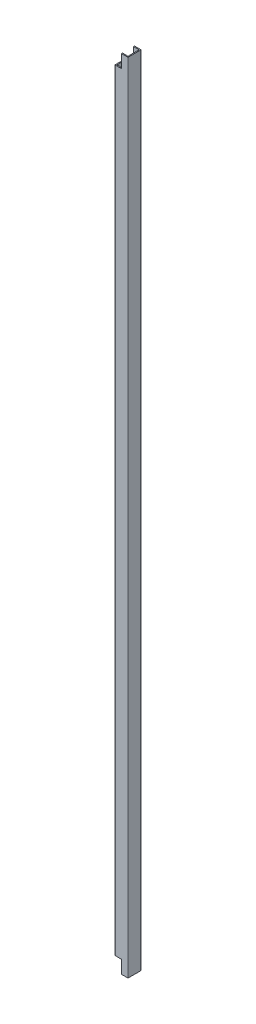
from build123d import *

# Parameters (mm, degrees)
SKETCH1_W                   = 17
SKETCH1_H                   = 17
BOSS_EXTRUDE1_DEPTH         = 1220
CUT_EXTRUDE1_START          = -20
SKETCH2_W                   = 20
SKETCH2_H                   = 20
CUT_EXTRUDE1_DEPTH          = 10
CUT_EXTRUDE2_DEPTH          = 15
SKETCH4_W                   = 3
SKETCH4_H                   = 10
CUT_EXTRUDE3_DEPTH          = 10
SKETCH_PATTERN1_START       = -20
SKETCH_PATTERN1_DEPTH       = 15
SKETCH_PATTERN1_2_OUTLINE_W = 1.5
SKETCH_PATTERN1_2_OUTLINE_H = 10
SKETCH_PATTERN1_2_DEPTH     = 3


# Read off the part's stored shape, not the designer's step: Sketch-Pattern1
with BuildPart() as part:
    # Sketch1 → Boss-Extrude1 (new body)
    with BuildSketch(Plane(origin=(0, 0, 0), x_dir=(1, 0, 0), z_dir=(0, 1, 0))):
        with BuildLine():
            Line((0.5, 0), (19.5, 0))
            ThreePointArc((19.5, 0), (19.853553391, 0.146446609), (20, 0.5))
            Line((20, 0.5), (20, 19.5))
            ThreePointArc((20, 19.5), (19.853553391, 19.853553391), (19.5, 20))
            Line((19.5, 20), (0.5, 20))
            ThreePointArc((0.5, 20), (0.146446609, 19.853553391), (0, 19.5))
            Line((0, 19.5), (0, 0.5))
            ThreePointArc((0, 0.5), (0.146446609, 0.146446609), (0.5, 0))
        make_face()
        with Locations((10, 10)):
            Rectangle(SKETCH1_W, SKETCH1_H, mode=Mode.SUBTRACT)
    extrude(amount=BOSS_EXTRUDE1_DEPTH)

    # Sketch2 → Cut-Extrude1 (cut)
    with BuildSketch(Plane(origin=(20, 0, 0), x_dir=(0, 0, -1), z_dir=(1, 0, 0)).offset(CUT_EXTRUDE1_START)):
        with Locations((10, 1210)):
            Rectangle(SKETCH2_W, SKETCH2_H)
        with Locations((10, 10)):
            Rectangle(SKETCH2_W, SKETCH2_H)
    extrude(amount=CUT_EXTRUDE1_DEPTH, mode=Mode.SUBTRACT)

    # Sketch3 → Cut-Extrude2 (cut)
    with BuildSketch(Plane(origin=(0, 0, -20), x_dir=(-1, 0, 0), z_dir=(0, 0, -1))):
        Polygon((-15, 1115), (0, 1115), (0, 1120), (-9, 1120), (-9, 1130), (0, 1130), (0, 1135), (-15, 1135), align=None)
    extrude(amount=-CUT_EXTRUDE2_DEPTH, mode=Mode.SUBTRACT)

    # Sketch4 → Cut-Extrude3 (cut)
    with BuildSketch(Plane.ZY):
        with Locations((-18.5, 1125)):
            Rectangle(SKETCH4_W, SKETCH4_H)
    extrude(amount=-CUT_EXTRUDE3_DEPTH, mode=Mode.SUBTRACT)

    # Sketch-Pattern1 outline → Sketch-Pattern1 (cut)
    with BuildSketch(Plane.XY.offset(SKETCH_PATTERN1_START)):
        Polygon((15, 85), (15, 105), (0, 105), (0, 100), (1.5, 100), (1.5, 90), (0, 90), (0, 85), align=None)
        Polygon((1.5, 330), (1.5, 320), (0, 320), (0, 315), (15, 315), (15, 335), (0, 335), (0, 330), align=None)
        Polygon((1.5, 500), (1.5, 490), (0, 490), (0, 485), (15, 485), (15, 505), (0, 505), (0, 500), align=None)
        Polygon((1.5, 730), (1.5, 720), (0, 720), (0, 715), (15, 715), (15, 735), (0, 735), (0, 730), align=None)
        Polygon((1.5, 900), (1.5, 890), (0, 890), (0, 885), (15, 885), (15, 905), (0, 905), (0, 900), align=None)
    extrude(amount=SKETCH_PATTERN1_DEPTH, mode=Mode.SUBTRACT)

    # Sketch-Pattern1 2 outline → Sketch-Pattern1 2 (cut)
    with BuildSketch(Plane.XY.offset(SKETCH_PATTERN1_START)):
        with Locations((0.75, 95)):
            Rectangle(SKETCH_PATTERN1_2_OUTLINE_W, SKETCH_PATTERN1_2_OUTLINE_H)
        with Locations((0.75, 325)):
            Rectangle(SKETCH_PATTERN1_2_OUTLINE_W, SKETCH_PATTERN1_2_OUTLINE_H)
        with Locations((0.75, 495)):
            Rectangle(SKETCH_PATTERN1_2_OUTLINE_W, SKETCH_PATTERN1_2_OUTLINE_H)
        with Locations((0.75, 725)):
            Rectangle(SKETCH_PATTERN1_2_OUTLINE_W, SKETCH_PATTERN1_2_OUTLINE_H)
        with Locations((0.75, 895)):
            Rectangle(SKETCH_PATTERN1_2_OUTLINE_W, SKETCH_PATTERN1_2_OUTLINE_H)
    extrude(amount=SKETCH_PATTERN1_2_DEPTH, mode=Mode.SUBTRACT)


solid = part.part
